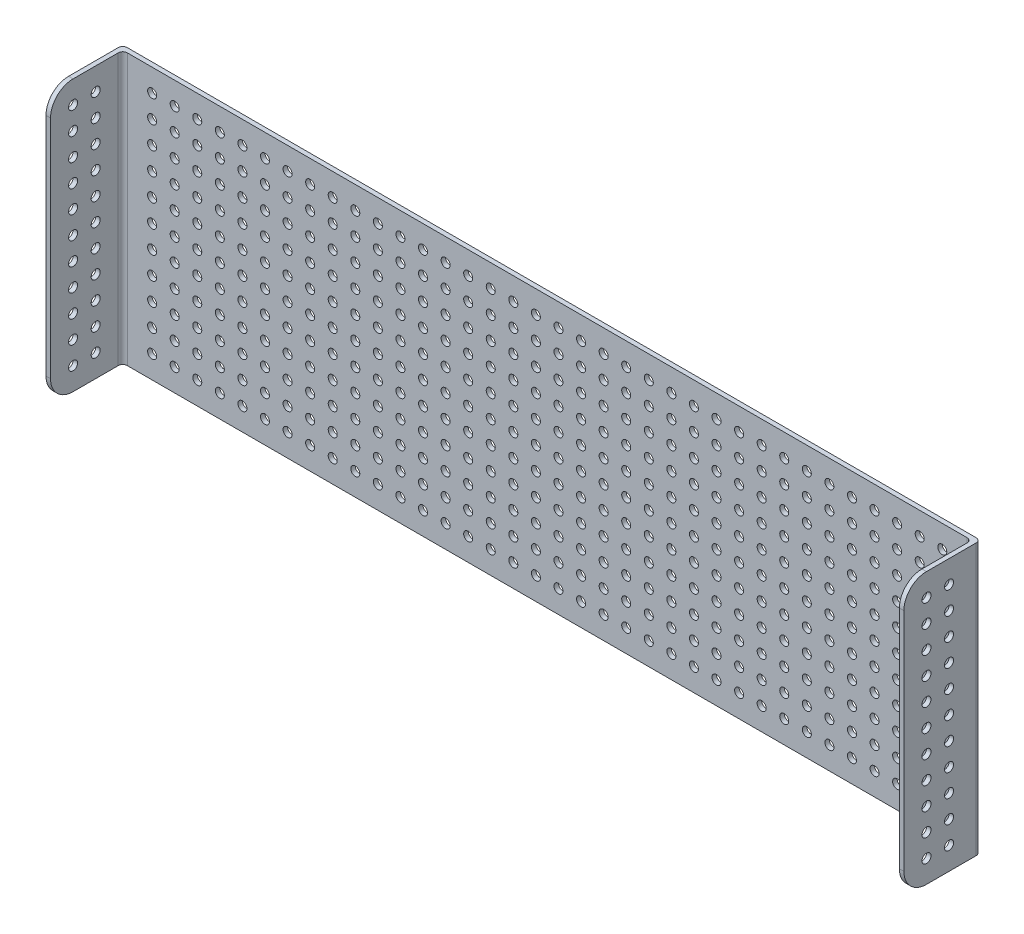
from build123d import *

# Parameters (mm, degrees)
IZIM1_W             = 380
IZIM1_H             = 120
IZIM1_R             = 2
BOSS_EXTRUDE1_DEPTH = 2
IZIM3_W             = 2
IZIM3_H             = 120
TOP_HOLES_DEPTH     = 32
IZIM4_R             = 2
CUT_EXTRUDE1_DEPTH  = 393.770402665
FILLET1_R           = 2
FILLET2_R           = 10


with BuildPart() as part:
    # Çizim1 → Boss-Extrude1 (new body)
    with BuildSketch(Plane.XY):
        with Locations((124.668181205, -33.341251384)):
            Rectangle(IZIM1_W, IZIM1_H)
        with Locations((299.668181205, 16.658748616)):
            Circle(IZIM1_R, mode=Mode.SUBTRACT)
        with Locations((289.668181205, 16.658748616)):
            Circle(IZIM1_R, mode=Mode.SUBTRACT)
        with Locations((279.668181205, 16.658748616)):
            Circle(IZIM1_R, mode=Mode.SUBTRACT)
        with Locations((269.668181205, 16.658748616)):
            Circle(IZIM1_R, mode=Mode.SUBTRACT)
        with Locations((259.668181205, 16.658748616)):
            Circle(IZIM1_R, mode=Mode.SUBTRACT)
        with Locations((249.668181205, 16.658748616)):
            Circle(IZIM1_R, mode=Mode.SUBTRACT)
        with Locations((239.668181205, 16.658748616)):
            Circle(IZIM1_R, mode=Mode.SUBTRACT)
        with Locations((229.668181205, 16.658748616)):
            Circle(IZIM1_R, mode=Mode.SUBTRACT)
        with Locations((219.668181205, 16.658748616)):
            Circle(IZIM1_R, mode=Mode.SUBTRACT)
        with Locations((209.668181205, 16.658748616)):
            Circle(IZIM1_R, mode=Mode.SUBTRACT)
        with Locations((199.668181205, 16.658748616)):
            Circle(IZIM1_R, mode=Mode.SUBTRACT)
        with Locations((189.668181205, 16.658748616)):
            Circle(IZIM1_R, mode=Mode.SUBTRACT)
        with Locations((179.668181205, 16.658748616)):
            Circle(IZIM1_R, mode=Mode.SUBTRACT)
        with Locations((169.668181205, 16.658748616)):
            Circle(IZIM1_R, mode=Mode.SUBTRACT)
        with Locations((159.668181205, 16.658748616)):
            Circle(IZIM1_R, mode=Mode.SUBTRACT)
        with Locations((149.668181205, 16.658748616)):
            Circle(IZIM1_R, mode=Mode.SUBTRACT)
        with Locations((139.668181205, 16.658748616)):
            Circle(IZIM1_R, mode=Mode.SUBTRACT)
        with Locations((129.668181205, 16.658748616)):
            Circle(IZIM1_R, mode=Mode.SUBTRACT)
        with Locations((119.668181205, 16.658748616)):
            Circle(IZIM1_R, mode=Mode.SUBTRACT)
        with Locations((109.668181205, 16.658748616)):
            Circle(IZIM1_R, mode=Mode.SUBTRACT)
        with Locations((99.668181205, 16.658748616)):
            Circle(IZIM1_R, mode=Mode.SUBTRACT)
        with Locations((89.668181205, 16.658748616)):
            Circle(IZIM1_R, mode=Mode.SUBTRACT)
        with Locations((79.668181205, 16.658748616)):
            Circle(IZIM1_R, mode=Mode.SUBTRACT)
        with Locations((69.668181205, 16.658748616)):
            Circle(IZIM1_R, mode=Mode.SUBTRACT)
        with Locations((59.668181205, 16.658748616)):
            Circle(IZIM1_R, mode=Mode.SUBTRACT)
        with Locations((49.668181205, 16.658748616)):
            Circle(IZIM1_R, mode=Mode.SUBTRACT)
        with Locations((39.668181205, 16.658748616)):
            Circle(IZIM1_R, mode=Mode.SUBTRACT)
        with Locations((29.668181205, 16.658748616)):
            Circle(IZIM1_R, mode=Mode.SUBTRACT)
        with Locations((19.668181205, 16.658748616)):
            Circle(IZIM1_R, mode=Mode.SUBTRACT)
        with Locations((9.668181205, 16.658748616)):
            Circle(IZIM1_R, mode=Mode.SUBTRACT)
        with Locations((-0.331818795, 16.658748616)):
            Circle(IZIM1_R, mode=Mode.SUBTRACT)
        with Locations((-10.331818795, 16.658748616)):
            Circle(IZIM1_R, mode=Mode.SUBTRACT)
        with Locations((-20.331818795, 16.658748616)):
            Circle(IZIM1_R, mode=Mode.SUBTRACT)
        with Locations((-30.331818795, 16.658748616)):
            Circle(IZIM1_R, mode=Mode.SUBTRACT)
        with Locations((-40.331818795, 16.658748616)):
            Circle(IZIM1_R, mode=Mode.SUBTRACT)
        with Locations((-50.331818795, 16.658748616)):
            Circle(IZIM1_R, mode=Mode.SUBTRACT)
        with Locations((289.668181205, 6.658748616)):
            Circle(IZIM1_R, mode=Mode.SUBTRACT)
        with Locations((279.668181205, 6.658748616)):
            Circle(IZIM1_R, mode=Mode.SUBTRACT)
        with Locations((269.668181205, 6.658748616)):
            Circle(IZIM1_R, mode=Mode.SUBTRACT)
        with Locations((259.668181205, 6.658748616)):
            Circle(IZIM1_R, mode=Mode.SUBTRACT)
        with Locations((249.668181205, 6.658748616)):
            Circle(IZIM1_R, mode=Mode.SUBTRACT)
        with Locations((239.668181205, 6.658748616)):
            Circle(IZIM1_R, mode=Mode.SUBTRACT)
        with Locations((229.668181205, 6.658748616)):
            Circle(IZIM1_R, mode=Mode.SUBTRACT)
        with Locations((219.668181205, 6.658748616)):
            Circle(IZIM1_R, mode=Mode.SUBTRACT)
        with Locations((209.668181205, 6.658748616)):
            Circle(IZIM1_R, mode=Mode.SUBTRACT)
        with Locations((199.668181205, 6.658748616)):
            Circle(IZIM1_R, mode=Mode.SUBTRACT)
        with Locations((189.668181205, 6.658748616)):
            Circle(IZIM1_R, mode=Mode.SUBTRACT)
        with Locations((179.668181205, 6.658748616)):
            Circle(IZIM1_R, mode=Mode.SUBTRACT)
        with Locations((169.668181205, 6.658748616)):
            Circle(IZIM1_R, mode=Mode.SUBTRACT)
        with Locations((159.668181205, 6.658748616)):
            Circle(IZIM1_R, mode=Mode.SUBTRACT)
        with Locations((149.668181205, 6.658748616)):
            Circle(IZIM1_R, mode=Mode.SUBTRACT)
        with Locations((139.668181205, 6.658748616)):
            Circle(IZIM1_R, mode=Mode.SUBTRACT)
        with Locations((129.668181205, 6.658748616)):
            Circle(IZIM1_R, mode=Mode.SUBTRACT)
        with Locations((119.668181205, 6.658748616)):
            Circle(IZIM1_R, mode=Mode.SUBTRACT)
        with Locations((109.668181205, 6.658748616)):
            Circle(IZIM1_R, mode=Mode.SUBTRACT)
        with Locations((99.668181205, 6.658748616)):
            Circle(IZIM1_R, mode=Mode.SUBTRACT)
        with Locations((89.668181205, 6.658748616)):
            Circle(IZIM1_R, mode=Mode.SUBTRACT)
        with Locations((79.668181205, 6.658748616)):
            Circle(IZIM1_R, mode=Mode.SUBTRACT)
        with Locations((69.668181205, 6.658748616)):
            Circle(IZIM1_R, mode=Mode.SUBTRACT)
        with Locations((59.668181205, 6.658748616)):
            Circle(IZIM1_R, mode=Mode.SUBTRACT)
        with Locations((49.668181205, 6.658748616)):
            Circle(IZIM1_R, mode=Mode.SUBTRACT)
        with Locations((39.668181205, 6.658748616)):
            Circle(IZIM1_R, mode=Mode.SUBTRACT)
        with Locations((29.668181205, 6.658748616)):
            Circle(IZIM1_R, mode=Mode.SUBTRACT)
        with Locations((19.668181205, 6.658748616)):
            Circle(IZIM1_R, mode=Mode.SUBTRACT)
        with Locations((9.668181205, 6.658748616)):
            Circle(IZIM1_R, mode=Mode.SUBTRACT)
        with Locations((-0.331818795, 6.658748616)):
            Circle(IZIM1_R, mode=Mode.SUBTRACT)
        with Locations((-10.331818795, 6.658748616)):
            Circle(IZIM1_R, mode=Mode.SUBTRACT)
        with Locations((-20.331818795, 6.658748616)):
            Circle(IZIM1_R, mode=Mode.SUBTRACT)
        with Locations((-30.331818795, 6.658748616)):
            Circle(IZIM1_R, mode=Mode.SUBTRACT)
        with Locations((-40.331818795, 6.658748616)):
            Circle(IZIM1_R, mode=Mode.SUBTRACT)
        with Locations((-50.331818795, 6.658748616)):
            Circle(IZIM1_R, mode=Mode.SUBTRACT)
        with Locations((289.668181205, -3.341251384)):
            Circle(IZIM1_R, mode=Mode.SUBTRACT)
        with Locations((279.668181205, -3.341251384)):
            Circle(IZIM1_R, mode=Mode.SUBTRACT)
        with Locations((269.668181205, -3.341251384)):
            Circle(IZIM1_R, mode=Mode.SUBTRACT)
        with Locations((259.668181205, -3.341251384)):
            Circle(IZIM1_R, mode=Mode.SUBTRACT)
        with Locations((249.668181205, -3.341251384)):
            Circle(IZIM1_R, mode=Mode.SUBTRACT)
        with Locations((239.668181205, -3.341251384)):
            Circle(IZIM1_R, mode=Mode.SUBTRACT)
        with Locations((229.668181205, -3.341251384)):
            Circle(IZIM1_R, mode=Mode.SUBTRACT)
        with Locations((219.668181205, -3.341251384)):
            Circle(IZIM1_R, mode=Mode.SUBTRACT)
        with Locations((209.668181205, -3.341251384)):
            Circle(IZIM1_R, mode=Mode.SUBTRACT)
        with Locations((199.668181205, -3.341251384)):
            Circle(IZIM1_R, mode=Mode.SUBTRACT)
        with Locations((189.668181205, -3.341251384)):
            Circle(IZIM1_R, mode=Mode.SUBTRACT)
        with Locations((179.668181205, -3.341251384)):
            Circle(IZIM1_R, mode=Mode.SUBTRACT)
        with Locations((169.668181205, -3.341251384)):
            Circle(IZIM1_R, mode=Mode.SUBTRACT)
        with Locations((159.668181205, -3.341251384)):
            Circle(IZIM1_R, mode=Mode.SUBTRACT)
        with Locations((149.668181205, -3.341251384)):
            Circle(IZIM1_R, mode=Mode.SUBTRACT)
        with Locations((139.668181205, -3.341251384)):
            Circle(IZIM1_R, mode=Mode.SUBTRACT)
        with Locations((129.668181205, -3.341251384)):
            Circle(IZIM1_R, mode=Mode.SUBTRACT)
        with Locations((119.668181205, -3.341251384)):
            Circle(IZIM1_R, mode=Mode.SUBTRACT)
        with Locations((109.668181205, -3.341251384)):
            Circle(IZIM1_R, mode=Mode.SUBTRACT)
        with Locations((99.668181205, -3.341251384)):
            Circle(IZIM1_R, mode=Mode.SUBTRACT)
        with Locations((89.668181205, -3.341251384)):
            Circle(IZIM1_R, mode=Mode.SUBTRACT)
        with Locations((79.668181205, -3.341251384)):
            Circle(IZIM1_R, mode=Mode.SUBTRACT)
        with Locations((69.668181205, -3.341251384)):
            Circle(IZIM1_R, mode=Mode.SUBTRACT)
        with Locations((59.668181205, -3.341251384)):
            Circle(IZIM1_R, mode=Mode.SUBTRACT)
        with Locations((49.668181205, -3.341251384)):
            Circle(IZIM1_R, mode=Mode.SUBTRACT)
        with Locations((39.668181205, -3.341251384)):
            Circle(IZIM1_R, mode=Mode.SUBTRACT)
        with Locations((29.668181205, -3.341251384)):
            Circle(IZIM1_R, mode=Mode.SUBTRACT)
        with Locations((19.668181205, -3.341251384)):
            Circle(IZIM1_R, mode=Mode.SUBTRACT)
        with Locations((9.668181205, -3.341251384)):
            Circle(IZIM1_R, mode=Mode.SUBTRACT)
        with Locations((-0.331818795, -3.341251384)):
            Circle(IZIM1_R, mode=Mode.SUBTRACT)
        with Locations((-10.331818795, -3.341251384)):
            Circle(IZIM1_R, mode=Mode.SUBTRACT)
        with Locations((-20.331818795, -3.341251384)):
            Circle(IZIM1_R, mode=Mode.SUBTRACT)
        with Locations((-30.331818795, -3.341251384)):
            Circle(IZIM1_R, mode=Mode.SUBTRACT)
        with Locations((-40.331818795, -3.341251384)):
            Circle(IZIM1_R, mode=Mode.SUBTRACT)
        with Locations((-50.331818795, -3.341251384)):
            Circle(IZIM1_R, mode=Mode.SUBTRACT)
        with Locations((289.668181205, -13.341251384)):
            Circle(IZIM1_R, mode=Mode.SUBTRACT)
        with Locations((279.668181205, -13.341251384)):
            Circle(IZIM1_R, mode=Mode.SUBTRACT)
        with Locations((269.668181205, -13.341251384)):
            Circle(IZIM1_R, mode=Mode.SUBTRACT)
        with Locations((259.668181205, -13.341251384)):
            Circle(IZIM1_R, mode=Mode.SUBTRACT)
        with Locations((249.668181205, -13.341251384)):
            Circle(IZIM1_R, mode=Mode.SUBTRACT)
        with Locations((239.668181205, -13.341251384)):
            Circle(IZIM1_R, mode=Mode.SUBTRACT)
        with Locations((229.668181205, -13.341251384)):
            Circle(IZIM1_R, mode=Mode.SUBTRACT)
        with Locations((219.668181205, -13.341251384)):
            Circle(IZIM1_R, mode=Mode.SUBTRACT)
        with Locations((209.668181205, -13.341251384)):
            Circle(IZIM1_R, mode=Mode.SUBTRACT)
        with Locations((199.668181205, -13.341251384)):
            Circle(IZIM1_R, mode=Mode.SUBTRACT)
        with Locations((189.668181205, -13.341251384)):
            Circle(IZIM1_R, mode=Mode.SUBTRACT)
        with Locations((179.668181205, -13.341251384)):
            Circle(IZIM1_R, mode=Mode.SUBTRACT)
        with Locations((169.668181205, -13.341251384)):
            Circle(IZIM1_R, mode=Mode.SUBTRACT)
        with Locations((159.668181205, -13.341251384)):
            Circle(IZIM1_R, mode=Mode.SUBTRACT)
        with Locations((149.668181205, -13.341251384)):
            Circle(IZIM1_R, mode=Mode.SUBTRACT)
        with Locations((139.668181205, -13.341251384)):
            Circle(IZIM1_R, mode=Mode.SUBTRACT)
        with Locations((129.668181205, -13.341251384)):
            Circle(IZIM1_R, mode=Mode.SUBTRACT)
        with Locations((119.668181205, -13.341251384)):
            Circle(IZIM1_R, mode=Mode.SUBTRACT)
        with Locations((109.668181205, -13.341251384)):
            Circle(IZIM1_R, mode=Mode.SUBTRACT)
        with Locations((99.668181205, -13.341251384)):
            Circle(IZIM1_R, mode=Mode.SUBTRACT)
        with Locations((89.668181205, -13.341251384)):
            Circle(IZIM1_R, mode=Mode.SUBTRACT)
        with Locations((79.668181205, -13.341251384)):
            Circle(IZIM1_R, mode=Mode.SUBTRACT)
        with Locations((69.668181205, -13.341251384)):
            Circle(IZIM1_R, mode=Mode.SUBTRACT)
        with Locations((59.668181205, -13.341251384)):
            Circle(IZIM1_R, mode=Mode.SUBTRACT)
        with Locations((49.668181205, -13.341251384)):
            Circle(IZIM1_R, mode=Mode.SUBTRACT)
        with Locations((39.668181205, -13.341251384)):
            Circle(IZIM1_R, mode=Mode.SUBTRACT)
        with Locations((29.668181205, -13.341251384)):
            Circle(IZIM1_R, mode=Mode.SUBTRACT)
        with Locations((19.668181205, -13.341251384)):
            Circle(IZIM1_R, mode=Mode.SUBTRACT)
        with Locations((9.668181205, -13.341251384)):
            Circle(IZIM1_R, mode=Mode.SUBTRACT)
        with Locations((-0.331818795, -13.341251384)):
            Circle(IZIM1_R, mode=Mode.SUBTRACT)
        with Locations((-10.331818795, -13.341251384)):
            Circle(IZIM1_R, mode=Mode.SUBTRACT)
        with Locations((-20.331818795, -13.341251384)):
            Circle(IZIM1_R, mode=Mode.SUBTRACT)
        with Locations((-30.331818795, -13.341251384)):
            Circle(IZIM1_R, mode=Mode.SUBTRACT)
        with Locations((-40.331818795, -13.341251384)):
            Circle(IZIM1_R, mode=Mode.SUBTRACT)
        with Locations((-50.331818795, -13.341251384)):
            Circle(IZIM1_R, mode=Mode.SUBTRACT)
        with Locations((289.668181205, -23.341251384)):
            Circle(IZIM1_R, mode=Mode.SUBTRACT)
        with Locations((279.668181205, -23.341251384)):
            Circle(IZIM1_R, mode=Mode.SUBTRACT)
        with Locations((269.668181205, -23.341251384)):
            Circle(IZIM1_R, mode=Mode.SUBTRACT)
        with Locations((259.668181205, -23.341251384)):
            Circle(IZIM1_R, mode=Mode.SUBTRACT)
        with Locations((249.668181205, -23.341251384)):
            Circle(IZIM1_R, mode=Mode.SUBTRACT)
        with Locations((239.668181205, -23.341251384)):
            Circle(IZIM1_R, mode=Mode.SUBTRACT)
        with Locations((229.668181205, -23.341251384)):
            Circle(IZIM1_R, mode=Mode.SUBTRACT)
        with Locations((219.668181205, -23.341251384)):
            Circle(IZIM1_R, mode=Mode.SUBTRACT)
        with Locations((209.668181205, -23.341251384)):
            Circle(IZIM1_R, mode=Mode.SUBTRACT)
        with Locations((199.668181205, -23.341251384)):
            Circle(IZIM1_R, mode=Mode.SUBTRACT)
        with Locations((189.668181205, -23.341251384)):
            Circle(IZIM1_R, mode=Mode.SUBTRACT)
        with Locations((179.668181205, -23.341251384)):
            Circle(IZIM1_R, mode=Mode.SUBTRACT)
        with Locations((169.668181205, -23.341251384)):
            Circle(IZIM1_R, mode=Mode.SUBTRACT)
        with Locations((159.668181205, -23.341251384)):
            Circle(IZIM1_R, mode=Mode.SUBTRACT)
        with Locations((149.668181205, -23.341251384)):
            Circle(IZIM1_R, mode=Mode.SUBTRACT)
        with Locations((139.668181205, -23.341251384)):
            Circle(IZIM1_R, mode=Mode.SUBTRACT)
        with Locations((129.668181205, -23.341251384)):
            Circle(IZIM1_R, mode=Mode.SUBTRACT)
        with Locations((119.668181205, -23.341251384)):
            Circle(IZIM1_R, mode=Mode.SUBTRACT)
        with Locations((109.668181205, -23.341251384)):
            Circle(IZIM1_R, mode=Mode.SUBTRACT)
        with Locations((99.668181205, -23.341251384)):
            Circle(IZIM1_R, mode=Mode.SUBTRACT)
        with Locations((89.668181205, -23.341251384)):
            Circle(IZIM1_R, mode=Mode.SUBTRACT)
        with Locations((79.668181205, -23.341251384)):
            Circle(IZIM1_R, mode=Mode.SUBTRACT)
        with Locations((69.668181205, -23.341251384)):
            Circle(IZIM1_R, mode=Mode.SUBTRACT)
        with Locations((59.668181205, -23.341251384)):
            Circle(IZIM1_R, mode=Mode.SUBTRACT)
        with Locations((49.668181205, -23.341251384)):
            Circle(IZIM1_R, mode=Mode.SUBTRACT)
        with Locations((39.668181205, -23.341251384)):
            Circle(IZIM1_R, mode=Mode.SUBTRACT)
        with Locations((29.668181205, -23.341251384)):
            Circle(IZIM1_R, mode=Mode.SUBTRACT)
        with Locations((19.668181205, -23.341251384)):
            Circle(IZIM1_R, mode=Mode.SUBTRACT)
        with Locations((9.668181205, -23.341251384)):
            Circle(IZIM1_R, mode=Mode.SUBTRACT)
        with Locations((-0.331818795, -23.341251384)):
            Circle(IZIM1_R, mode=Mode.SUBTRACT)
        with Locations((-10.331818795, -23.341251384)):
            Circle(IZIM1_R, mode=Mode.SUBTRACT)
        with Locations((-20.331818795, -23.341251384)):
            Circle(IZIM1_R, mode=Mode.SUBTRACT)
        with Locations((-30.331818795, -23.341251384)):
            Circle(IZIM1_R, mode=Mode.SUBTRACT)
        with Locations((-40.331818795, -23.341251384)):
            Circle(IZIM1_R, mode=Mode.SUBTRACT)
        with Locations((-50.331818795, -23.341251384)):
            Circle(IZIM1_R, mode=Mode.SUBTRACT)
        with Locations((289.668181205, -33.341251384)):
            Circle(IZIM1_R, mode=Mode.SUBTRACT)
        with Locations((279.668181205, -33.341251384)):
            Circle(IZIM1_R, mode=Mode.SUBTRACT)
        with Locations((269.668181205, -33.341251384)):
            Circle(IZIM1_R, mode=Mode.SUBTRACT)
        with Locations((259.668181205, -33.341251384)):
            Circle(IZIM1_R, mode=Mode.SUBTRACT)
        with Locations((249.668181205, -33.341251384)):
            Circle(IZIM1_R, mode=Mode.SUBTRACT)
        with Locations((239.668181205, -33.341251384)):
            Circle(IZIM1_R, mode=Mode.SUBTRACT)
        with Locations((229.668181205, -33.341251384)):
            Circle(IZIM1_R, mode=Mode.SUBTRACT)
        with Locations((219.668181205, -33.341251384)):
            Circle(IZIM1_R, mode=Mode.SUBTRACT)
        with Locations((209.668181205, -33.341251384)):
            Circle(IZIM1_R, mode=Mode.SUBTRACT)
        with Locations((199.668181205, -33.341251384)):
            Circle(IZIM1_R, mode=Mode.SUBTRACT)
        with Locations((189.668181205, -33.341251384)):
            Circle(IZIM1_R, mode=Mode.SUBTRACT)
        with Locations((179.668181205, -33.341251384)):
            Circle(IZIM1_R, mode=Mode.SUBTRACT)
        with Locations((169.668181205, -33.341251384)):
            Circle(IZIM1_R, mode=Mode.SUBTRACT)
        with Locations((159.668181205, -33.341251384)):
            Circle(IZIM1_R, mode=Mode.SUBTRACT)
        with Locations((149.668181205, -33.341251384)):
            Circle(IZIM1_R, mode=Mode.SUBTRACT)
        with Locations((139.668181205, -33.341251384)):
            Circle(IZIM1_R, mode=Mode.SUBTRACT)
        with Locations((129.668181205, -33.341251384)):
            Circle(IZIM1_R, mode=Mode.SUBTRACT)
        with Locations((119.668181205, -33.341251384)):
            Circle(IZIM1_R, mode=Mode.SUBTRACT)
        with Locations((109.668181205, -33.341251384)):
            Circle(IZIM1_R, mode=Mode.SUBTRACT)
        with Locations((99.668181205, -33.341251384)):
            Circle(IZIM1_R, mode=Mode.SUBTRACT)
        with Locations((89.668181205, -33.341251384)):
            Circle(IZIM1_R, mode=Mode.SUBTRACT)
        with Locations((79.668181205, -33.341251384)):
            Circle(IZIM1_R, mode=Mode.SUBTRACT)
        with Locations((69.668181205, -33.341251384)):
            Circle(IZIM1_R, mode=Mode.SUBTRACT)
        with Locations((59.668181205, -33.341251384)):
            Circle(IZIM1_R, mode=Mode.SUBTRACT)
        with Locations((49.668181205, -33.341251384)):
            Circle(IZIM1_R, mode=Mode.SUBTRACT)
        with Locations((39.668181205, -33.341251384)):
            Circle(IZIM1_R, mode=Mode.SUBTRACT)
        with Locations((29.668181205, -33.341251384)):
            Circle(IZIM1_R, mode=Mode.SUBTRACT)
        with Locations((19.668181205, -33.341251384)):
            Circle(IZIM1_R, mode=Mode.SUBTRACT)
        with Locations((9.668181205, -33.341251384)):
            Circle(IZIM1_R, mode=Mode.SUBTRACT)
        with Locations((-0.331818795, -33.341251384)):
            Circle(IZIM1_R, mode=Mode.SUBTRACT)
        with Locations((-10.331818795, -33.341251384)):
            Circle(IZIM1_R, mode=Mode.SUBTRACT)
        with Locations((-20.331818795, -33.341251384)):
            Circle(IZIM1_R, mode=Mode.SUBTRACT)
        with Locations((-30.331818795, -33.341251384)):
            Circle(IZIM1_R, mode=Mode.SUBTRACT)
        with Locations((-40.331818795, -33.341251384)):
            Circle(IZIM1_R, mode=Mode.SUBTRACT)
        with Locations((-50.331818795, -33.341251384)):
            Circle(IZIM1_R, mode=Mode.SUBTRACT)
        with Locations((289.668181205, -43.341251384)):
            Circle(IZIM1_R, mode=Mode.SUBTRACT)
        with Locations((279.668181205, -43.341251384)):
            Circle(IZIM1_R, mode=Mode.SUBTRACT)
        with Locations((269.668181205, -43.341251384)):
            Circle(IZIM1_R, mode=Mode.SUBTRACT)
        with Locations((259.668181205, -43.341251384)):
            Circle(IZIM1_R, mode=Mode.SUBTRACT)
        with Locations((249.668181205, -43.341251384)):
            Circle(IZIM1_R, mode=Mode.SUBTRACT)
        with Locations((239.668181205, -43.341251384)):
            Circle(IZIM1_R, mode=Mode.SUBTRACT)
        with Locations((229.668181205, -43.341251384)):
            Circle(IZIM1_R, mode=Mode.SUBTRACT)
        with Locations((219.668181205, -43.341251384)):
            Circle(IZIM1_R, mode=Mode.SUBTRACT)
        with Locations((209.668181205, -43.341251384)):
            Circle(IZIM1_R, mode=Mode.SUBTRACT)
        with Locations((199.668181205, -43.341251384)):
            Circle(IZIM1_R, mode=Mode.SUBTRACT)
        with Locations((189.668181205, -43.341251384)):
            Circle(IZIM1_R, mode=Mode.SUBTRACT)
        with Locations((179.668181205, -43.341251384)):
            Circle(IZIM1_R, mode=Mode.SUBTRACT)
        with Locations((169.668181205, -43.341251384)):
            Circle(IZIM1_R, mode=Mode.SUBTRACT)
        with Locations((159.668181205, -43.341251384)):
            Circle(IZIM1_R, mode=Mode.SUBTRACT)
        with Locations((149.668181205, -43.341251384)):
            Circle(IZIM1_R, mode=Mode.SUBTRACT)
        with Locations((139.668181205, -43.341251384)):
            Circle(IZIM1_R, mode=Mode.SUBTRACT)
        with Locations((129.668181205, -43.341251384)):
            Circle(IZIM1_R, mode=Mode.SUBTRACT)
        with Locations((119.668181205, -43.341251384)):
            Circle(IZIM1_R, mode=Mode.SUBTRACT)
        with Locations((109.668181205, -43.341251384)):
            Circle(IZIM1_R, mode=Mode.SUBTRACT)
        with Locations((99.668181205, -43.341251384)):
            Circle(IZIM1_R, mode=Mode.SUBTRACT)
        with Locations((89.668181205, -43.341251384)):
            Circle(IZIM1_R, mode=Mode.SUBTRACT)
        with Locations((79.668181205, -43.341251384)):
            Circle(IZIM1_R, mode=Mode.SUBTRACT)
        with Locations((69.668181205, -43.341251384)):
            Circle(IZIM1_R, mode=Mode.SUBTRACT)
        with Locations((59.668181205, -43.341251384)):
            Circle(IZIM1_R, mode=Mode.SUBTRACT)
        with Locations((49.668181205, -43.341251384)):
            Circle(IZIM1_R, mode=Mode.SUBTRACT)
        with Locations((39.668181205, -43.341251384)):
            Circle(IZIM1_R, mode=Mode.SUBTRACT)
        with Locations((29.668181205, -43.341251384)):
            Circle(IZIM1_R, mode=Mode.SUBTRACT)
        with Locations((19.668181205, -43.341251384)):
            Circle(IZIM1_R, mode=Mode.SUBTRACT)
        with Locations((9.668181205, -43.341251384)):
            Circle(IZIM1_R, mode=Mode.SUBTRACT)
        with Locations((-0.331818795, -43.341251384)):
            Circle(IZIM1_R, mode=Mode.SUBTRACT)
        with Locations((-10.331818795, -43.341251384)):
            Circle(IZIM1_R, mode=Mode.SUBTRACT)
        with Locations((-20.331818795, -43.341251384)):
            Circle(IZIM1_R, mode=Mode.SUBTRACT)
        with Locations((-30.331818795, -43.341251384)):
            Circle(IZIM1_R, mode=Mode.SUBTRACT)
        with Locations((-40.331818795, -43.341251384)):
            Circle(IZIM1_R, mode=Mode.SUBTRACT)
        with Locations((-50.331818795, -43.341251384)):
            Circle(IZIM1_R, mode=Mode.SUBTRACT)
        with Locations((289.668181205, -53.341251384)):
            Circle(IZIM1_R, mode=Mode.SUBTRACT)
        with Locations((279.668181205, -53.341251384)):
            Circle(IZIM1_R, mode=Mode.SUBTRACT)
        with Locations((269.668181205, -53.341251384)):
            Circle(IZIM1_R, mode=Mode.SUBTRACT)
        with Locations((259.668181205, -53.341251384)):
            Circle(IZIM1_R, mode=Mode.SUBTRACT)
        with Locations((249.668181205, -53.341251384)):
            Circle(IZIM1_R, mode=Mode.SUBTRACT)
        with Locations((239.668181205, -53.341251384)):
            Circle(IZIM1_R, mode=Mode.SUBTRACT)
        with Locations((229.668181205, -53.341251384)):
            Circle(IZIM1_R, mode=Mode.SUBTRACT)
        with Locations((219.668181205, -53.341251384)):
            Circle(IZIM1_R, mode=Mode.SUBTRACT)
        with Locations((209.668181205, -53.341251384)):
            Circle(IZIM1_R, mode=Mode.SUBTRACT)
        with Locations((199.668181205, -53.341251384)):
            Circle(IZIM1_R, mode=Mode.SUBTRACT)
        with Locations((189.668181205, -53.341251384)):
            Circle(IZIM1_R, mode=Mode.SUBTRACT)
        with Locations((179.668181205, -53.341251384)):
            Circle(IZIM1_R, mode=Mode.SUBTRACT)
        with Locations((169.668181205, -53.341251384)):
            Circle(IZIM1_R, mode=Mode.SUBTRACT)
        with Locations((159.668181205, -53.341251384)):
            Circle(IZIM1_R, mode=Mode.SUBTRACT)
        with Locations((149.668181205, -53.341251384)):
            Circle(IZIM1_R, mode=Mode.SUBTRACT)
        with Locations((139.668181205, -53.341251384)):
            Circle(IZIM1_R, mode=Mode.SUBTRACT)
        with Locations((129.668181205, -53.341251384)):
            Circle(IZIM1_R, mode=Mode.SUBTRACT)
        with Locations((119.668181205, -53.341251384)):
            Circle(IZIM1_R, mode=Mode.SUBTRACT)
        with Locations((109.668181205, -53.341251384)):
            Circle(IZIM1_R, mode=Mode.SUBTRACT)
        with Locations((99.668181205, -53.341251384)):
            Circle(IZIM1_R, mode=Mode.SUBTRACT)
        with Locations((89.668181205, -53.341251384)):
            Circle(IZIM1_R, mode=Mode.SUBTRACT)
        with Locations((79.668181205, -53.341251384)):
            Circle(IZIM1_R, mode=Mode.SUBTRACT)
        with Locations((69.668181205, -53.341251384)):
            Circle(IZIM1_R, mode=Mode.SUBTRACT)
        with Locations((59.668181205, -53.341251384)):
            Circle(IZIM1_R, mode=Mode.SUBTRACT)
        with Locations((49.668181205, -53.341251384)):
            Circle(IZIM1_R, mode=Mode.SUBTRACT)
        with Locations((39.668181205, -53.341251384)):
            Circle(IZIM1_R, mode=Mode.SUBTRACT)
        with Locations((29.668181205, -53.341251384)):
            Circle(IZIM1_R, mode=Mode.SUBTRACT)
        with Locations((19.668181205, -53.341251384)):
            Circle(IZIM1_R, mode=Mode.SUBTRACT)
        with Locations((9.668181205, -53.341251384)):
            Circle(IZIM1_R, mode=Mode.SUBTRACT)
        with Locations((-0.331818795, -53.341251384)):
            Circle(IZIM1_R, mode=Mode.SUBTRACT)
        with Locations((-10.331818795, -53.341251384)):
            Circle(IZIM1_R, mode=Mode.SUBTRACT)
        with Locations((-20.331818795, -53.341251384)):
            Circle(IZIM1_R, mode=Mode.SUBTRACT)
        with Locations((-30.331818795, -53.341251384)):
            Circle(IZIM1_R, mode=Mode.SUBTRACT)
        with Locations((-40.331818795, -53.341251384)):
            Circle(IZIM1_R, mode=Mode.SUBTRACT)
        with Locations((-50.331818795, -53.341251384)):
            Circle(IZIM1_R, mode=Mode.SUBTRACT)
        with Locations((289.668181205, -63.341251384)):
            Circle(IZIM1_R, mode=Mode.SUBTRACT)
        with Locations((279.668181205, -63.341251384)):
            Circle(IZIM1_R, mode=Mode.SUBTRACT)
        with Locations((269.668181205, -63.341251384)):
            Circle(IZIM1_R, mode=Mode.SUBTRACT)
        with Locations((259.668181205, -63.341251384)):
            Circle(IZIM1_R, mode=Mode.SUBTRACT)
        with Locations((249.668181205, -63.341251384)):
            Circle(IZIM1_R, mode=Mode.SUBTRACT)
        with Locations((239.668181205, -63.341251384)):
            Circle(IZIM1_R, mode=Mode.SUBTRACT)
        with Locations((229.668181205, -63.341251384)):
            Circle(IZIM1_R, mode=Mode.SUBTRACT)
        with Locations((219.668181205, -63.341251384)):
            Circle(IZIM1_R, mode=Mode.SUBTRACT)
        with Locations((209.668181205, -63.341251384)):
            Circle(IZIM1_R, mode=Mode.SUBTRACT)
        with Locations((199.668181205, -63.341251384)):
            Circle(IZIM1_R, mode=Mode.SUBTRACT)
        with Locations((189.668181205, -63.341251384)):
            Circle(IZIM1_R, mode=Mode.SUBTRACT)
        with Locations((179.668181205, -63.341251384)):
            Circle(IZIM1_R, mode=Mode.SUBTRACT)
        with Locations((169.668181205, -63.341251384)):
            Circle(IZIM1_R, mode=Mode.SUBTRACT)
        with Locations((159.668181205, -63.341251384)):
            Circle(IZIM1_R, mode=Mode.SUBTRACT)
        with Locations((149.668181205, -63.341251384)):
            Circle(IZIM1_R, mode=Mode.SUBTRACT)
        with Locations((139.668181205, -63.341251384)):
            Circle(IZIM1_R, mode=Mode.SUBTRACT)
        with Locations((129.668181205, -63.341251384)):
            Circle(IZIM1_R, mode=Mode.SUBTRACT)
        with Locations((119.668181205, -63.341251384)):
            Circle(IZIM1_R, mode=Mode.SUBTRACT)
        with Locations((109.668181205, -63.341251384)):
            Circle(IZIM1_R, mode=Mode.SUBTRACT)
        with Locations((99.668181205, -63.341251384)):
            Circle(IZIM1_R, mode=Mode.SUBTRACT)
        with Locations((89.668181205, -63.341251384)):
            Circle(IZIM1_R, mode=Mode.SUBTRACT)
        with Locations((79.668181205, -63.341251384)):
            Circle(IZIM1_R, mode=Mode.SUBTRACT)
        with Locations((69.668181205, -63.341251384)):
            Circle(IZIM1_R, mode=Mode.SUBTRACT)
        with Locations((59.668181205, -63.341251384)):
            Circle(IZIM1_R, mode=Mode.SUBTRACT)
        with Locations((49.668181205, -63.341251384)):
            Circle(IZIM1_R, mode=Mode.SUBTRACT)
        with Locations((39.668181205, -63.341251384)):
            Circle(IZIM1_R, mode=Mode.SUBTRACT)
        with Locations((29.668181205, -63.341251384)):
            Circle(IZIM1_R, mode=Mode.SUBTRACT)
        with Locations((19.668181205, -63.341251384)):
            Circle(IZIM1_R, mode=Mode.SUBTRACT)
        with Locations((9.668181205, -63.341251384)):
            Circle(IZIM1_R, mode=Mode.SUBTRACT)
        with Locations((-0.331818795, -63.341251384)):
            Circle(IZIM1_R, mode=Mode.SUBTRACT)
        with Locations((-10.331818795, -63.341251384)):
            Circle(IZIM1_R, mode=Mode.SUBTRACT)
        with Locations((-20.331818795, -63.341251384)):
            Circle(IZIM1_R, mode=Mode.SUBTRACT)
        with Locations((-30.331818795, -63.341251384)):
            Circle(IZIM1_R, mode=Mode.SUBTRACT)
        with Locations((-40.331818795, -63.341251384)):
            Circle(IZIM1_R, mode=Mode.SUBTRACT)
        with Locations((-50.331818795, -63.341251384)):
            Circle(IZIM1_R, mode=Mode.SUBTRACT)
        with Locations((289.668181205, -73.341251384)):
            Circle(IZIM1_R, mode=Mode.SUBTRACT)
        with Locations((279.668181205, -73.341251384)):
            Circle(IZIM1_R, mode=Mode.SUBTRACT)
        with Locations((269.668181205, -73.341251384)):
            Circle(IZIM1_R, mode=Mode.SUBTRACT)
        with Locations((259.668181205, -73.341251384)):
            Circle(IZIM1_R, mode=Mode.SUBTRACT)
        with Locations((249.668181205, -73.341251384)):
            Circle(IZIM1_R, mode=Mode.SUBTRACT)
        with Locations((239.668181205, -73.341251384)):
            Circle(IZIM1_R, mode=Mode.SUBTRACT)
        with Locations((229.668181205, -73.341251384)):
            Circle(IZIM1_R, mode=Mode.SUBTRACT)
        with Locations((219.668181205, -73.341251384)):
            Circle(IZIM1_R, mode=Mode.SUBTRACT)
        with Locations((209.668181205, -73.341251384)):
            Circle(IZIM1_R, mode=Mode.SUBTRACT)
        with Locations((199.668181205, -73.341251384)):
            Circle(IZIM1_R, mode=Mode.SUBTRACT)
        with Locations((189.668181205, -73.341251384)):
            Circle(IZIM1_R, mode=Mode.SUBTRACT)
        with Locations((179.668181205, -73.341251384)):
            Circle(IZIM1_R, mode=Mode.SUBTRACT)
        with Locations((169.668181205, -73.341251384)):
            Circle(IZIM1_R, mode=Mode.SUBTRACT)
        with Locations((159.668181205, -73.341251384)):
            Circle(IZIM1_R, mode=Mode.SUBTRACT)
        with Locations((149.668181205, -73.341251384)):
            Circle(IZIM1_R, mode=Mode.SUBTRACT)
        with Locations((139.668181205, -73.341251384)):
            Circle(IZIM1_R, mode=Mode.SUBTRACT)
        with Locations((129.668181205, -73.341251384)):
            Circle(IZIM1_R, mode=Mode.SUBTRACT)
        with Locations((119.668181205, -73.341251384)):
            Circle(IZIM1_R, mode=Mode.SUBTRACT)
        with Locations((109.668181205, -73.341251384)):
            Circle(IZIM1_R, mode=Mode.SUBTRACT)
        with Locations((99.668181205, -73.341251384)):
            Circle(IZIM1_R, mode=Mode.SUBTRACT)
        with Locations((89.668181205, -73.341251384)):
            Circle(IZIM1_R, mode=Mode.SUBTRACT)
        with Locations((79.668181205, -73.341251384)):
            Circle(IZIM1_R, mode=Mode.SUBTRACT)
        with Locations((69.668181205, -73.341251384)):
            Circle(IZIM1_R, mode=Mode.SUBTRACT)
        with Locations((59.668181205, -73.341251384)):
            Circle(IZIM1_R, mode=Mode.SUBTRACT)
        with Locations((49.668181205, -73.341251384)):
            Circle(IZIM1_R, mode=Mode.SUBTRACT)
        with Locations((39.668181205, -73.341251384)):
            Circle(IZIM1_R, mode=Mode.SUBTRACT)
        with Locations((29.668181205, -73.341251384)):
            Circle(IZIM1_R, mode=Mode.SUBTRACT)
        with Locations((19.668181205, -73.341251384)):
            Circle(IZIM1_R, mode=Mode.SUBTRACT)
        with Locations((9.668181205, -73.341251384)):
            Circle(IZIM1_R, mode=Mode.SUBTRACT)
        with Locations((-0.331818795, -73.341251384)):
            Circle(IZIM1_R, mode=Mode.SUBTRACT)
        with Locations((-10.331818795, -73.341251384)):
            Circle(IZIM1_R, mode=Mode.SUBTRACT)
        with Locations((-20.331818795, -73.341251384)):
            Circle(IZIM1_R, mode=Mode.SUBTRACT)
        with Locations((-30.331818795, -73.341251384)):
            Circle(IZIM1_R, mode=Mode.SUBTRACT)
        with Locations((-40.331818795, -73.341251384)):
            Circle(IZIM1_R, mode=Mode.SUBTRACT)
        with Locations((-50.331818795, -73.341251384)):
            Circle(IZIM1_R, mode=Mode.SUBTRACT)
        with Locations((289.668181205, -83.341251384)):
            Circle(IZIM1_R, mode=Mode.SUBTRACT)
        with Locations((279.668181205, -83.341251384)):
            Circle(IZIM1_R, mode=Mode.SUBTRACT)
        with Locations((269.668181205, -83.341251384)):
            Circle(IZIM1_R, mode=Mode.SUBTRACT)
        with Locations((259.668181205, -83.341251384)):
            Circle(IZIM1_R, mode=Mode.SUBTRACT)
        with Locations((249.668181205, -83.341251384)):
            Circle(IZIM1_R, mode=Mode.SUBTRACT)
        with Locations((239.668181205, -83.341251384)):
            Circle(IZIM1_R, mode=Mode.SUBTRACT)
        with Locations((229.668181205, -83.341251384)):
            Circle(IZIM1_R, mode=Mode.SUBTRACT)
        with Locations((219.668181205, -83.341251384)):
            Circle(IZIM1_R, mode=Mode.SUBTRACT)
        with Locations((209.668181205, -83.341251384)):
            Circle(IZIM1_R, mode=Mode.SUBTRACT)
        with Locations((199.668181205, -83.341251384)):
            Circle(IZIM1_R, mode=Mode.SUBTRACT)
        with Locations((189.668181205, -83.341251384)):
            Circle(IZIM1_R, mode=Mode.SUBTRACT)
        with Locations((179.668181205, -83.341251384)):
            Circle(IZIM1_R, mode=Mode.SUBTRACT)
        with Locations((169.668181205, -83.341251384)):
            Circle(IZIM1_R, mode=Mode.SUBTRACT)
        with Locations((159.668181205, -83.341251384)):
            Circle(IZIM1_R, mode=Mode.SUBTRACT)
        with Locations((149.668181205, -83.341251384)):
            Circle(IZIM1_R, mode=Mode.SUBTRACT)
        with Locations((139.668181205, -83.341251384)):
            Circle(IZIM1_R, mode=Mode.SUBTRACT)
        with Locations((129.668181205, -83.341251384)):
            Circle(IZIM1_R, mode=Mode.SUBTRACT)
        with Locations((119.668181205, -83.341251384)):
            Circle(IZIM1_R, mode=Mode.SUBTRACT)
        with Locations((109.668181205, -83.341251384)):
            Circle(IZIM1_R, mode=Mode.SUBTRACT)
        with Locations((99.668181205, -83.341251384)):
            Circle(IZIM1_R, mode=Mode.SUBTRACT)
        with Locations((89.668181205, -83.341251384)):
            Circle(IZIM1_R, mode=Mode.SUBTRACT)
        with Locations((79.668181205, -83.341251384)):
            Circle(IZIM1_R, mode=Mode.SUBTRACT)
        with Locations((69.668181205, -83.341251384)):
            Circle(IZIM1_R, mode=Mode.SUBTRACT)
        with Locations((59.668181205, -83.341251384)):
            Circle(IZIM1_R, mode=Mode.SUBTRACT)
        with Locations((49.668181205, -83.341251384)):
            Circle(IZIM1_R, mode=Mode.SUBTRACT)
        with Locations((39.668181205, -83.341251384)):
            Circle(IZIM1_R, mode=Mode.SUBTRACT)
        with Locations((29.668181205, -83.341251384)):
            Circle(IZIM1_R, mode=Mode.SUBTRACT)
        with Locations((19.668181205, -83.341251384)):
            Circle(IZIM1_R, mode=Mode.SUBTRACT)
        with Locations((9.668181205, -83.341251384)):
            Circle(IZIM1_R, mode=Mode.SUBTRACT)
        with Locations((-0.331818795, -83.341251384)):
            Circle(IZIM1_R, mode=Mode.SUBTRACT)
        with Locations((-10.331818795, -83.341251384)):
            Circle(IZIM1_R, mode=Mode.SUBTRACT)
        with Locations((-20.331818795, -83.341251384)):
            Circle(IZIM1_R, mode=Mode.SUBTRACT)
        with Locations((-30.331818795, -83.341251384)):
            Circle(IZIM1_R, mode=Mode.SUBTRACT)
        with Locations((-40.331818795, -83.341251384)):
            Circle(IZIM1_R, mode=Mode.SUBTRACT)
        with Locations((-50.331818795, -83.341251384)):
            Circle(IZIM1_R, mode=Mode.SUBTRACT)
        with Locations((299.668181205, 6.658748616)):
            Circle(IZIM1_R, mode=Mode.SUBTRACT)
        with Locations((299.668181205, -3.341251384)):
            Circle(IZIM1_R, mode=Mode.SUBTRACT)
        with Locations((299.668181205, -13.341251384)):
            Circle(IZIM1_R, mode=Mode.SUBTRACT)
        with Locations((299.668181205, -23.341251384)):
            Circle(IZIM1_R, mode=Mode.SUBTRACT)
        with Locations((299.668181205, -33.341251384)):
            Circle(IZIM1_R, mode=Mode.SUBTRACT)
        with Locations((299.668181205, -43.341251384)):
            Circle(IZIM1_R, mode=Mode.SUBTRACT)
        with Locations((299.668181205, -53.341251384)):
            Circle(IZIM1_R, mode=Mode.SUBTRACT)
        with Locations((299.668181205, -63.341251384)):
            Circle(IZIM1_R, mode=Mode.SUBTRACT)
        with Locations((299.668181205, -73.341251384)):
            Circle(IZIM1_R, mode=Mode.SUBTRACT)
        with Locations((299.668181205, -83.341251384)):
            Circle(IZIM1_R, mode=Mode.SUBTRACT)
    extrude(amount=BOSS_EXTRUDE1_DEPTH)

    # Çizim3 → Top Holes (add)
    with BuildSketch(Plane.XY.offset(2)):
        with Locations((-64.331818795, -33.341251384)):
            Rectangle(IZIM3_W, IZIM3_H)
        with Locations((313.668181205, -33.341251384)):
            Rectangle(IZIM3_W, IZIM3_H)
    extrude(amount=TOP_HOLES_DEPTH)

    # Çizim4 → Cut-Extrude1 (cut, through all)
    with BuildSketch(Plane.ZY.offset(65.331818795)):
        with Locations((14, -83.341251384)):
            Circle(IZIM4_R)
        with Locations((24, -83.341251384)):
            Circle(IZIM4_R)
        with Locations((24, -73.341251384)):
            Circle(IZIM4_R)
        with Locations((24, -63.341251384)):
            Circle(IZIM4_R)
        with Locations((24, -53.341251384)):
            Circle(IZIM4_R)
        with Locations((24, -43.341251384)):
            Circle(IZIM4_R)
        with Locations((24, -33.341251384)):
            Circle(IZIM4_R)
        with Locations((24, -23.341251384)):
            Circle(IZIM4_R)
        with Locations((24, -13.341251384)):
            Circle(IZIM4_R)
        with Locations((24, -3.341251384)):
            Circle(IZIM4_R)
        with Locations((24, 6.658748616)):
            Circle(IZIM4_R)
        with Locations((24, 16.658748616)):
            Circle(IZIM4_R)
        with Locations((14, -73.341251384)):
            Circle(IZIM4_R)
        with Locations((14, -63.341251384)):
            Circle(IZIM4_R)
        with Locations((14, -53.341251384)):
            Circle(IZIM4_R)
        with Locations((14, -43.341251384)):
            Circle(IZIM4_R)
        with Locations((14, -33.341251384)):
            Circle(IZIM4_R)
        with Locations((14, -23.341251384)):
            Circle(IZIM4_R)
        with Locations((14, -13.341251384)):
            Circle(IZIM4_R)
        with Locations((14, -3.341251384)):
            Circle(IZIM4_R)
        with Locations((14, 6.658748616)):
            Circle(IZIM4_R)
        with Locations((14, 16.658748616)):
            Circle(IZIM4_R)
    extrude(amount=-CUT_EXTRUDE1_DEPTH, mode=Mode.SUBTRACT)

    # Fillet1
    fillet1_edges = [part.edges().sort_by_distance(p)[0] for p in [
        (-63.331818795, -33.341251384, 2),
        (314.668181205, -33.341251384, 0),
        (312.668181205, -33.341251384, 2),
        (-65.331818795, -33.341251384, 0),
    ]]
    fillet(fillet1_edges, radius=FILLET1_R)

    # Fillet2
    fillet2_edges = [part.edges().sort_by_distance(p)[0] for p in [
        (-64.331818795, -93.341251384, 34),
        (-64.331818795, 26.658748616, 34),
        (313.668181205, 26.658748616, 34),
        (313.668181205, -93.341251384, 34),
    ]]
    fillet(fillet2_edges, radius=FILLET2_R)


solid = part.part
